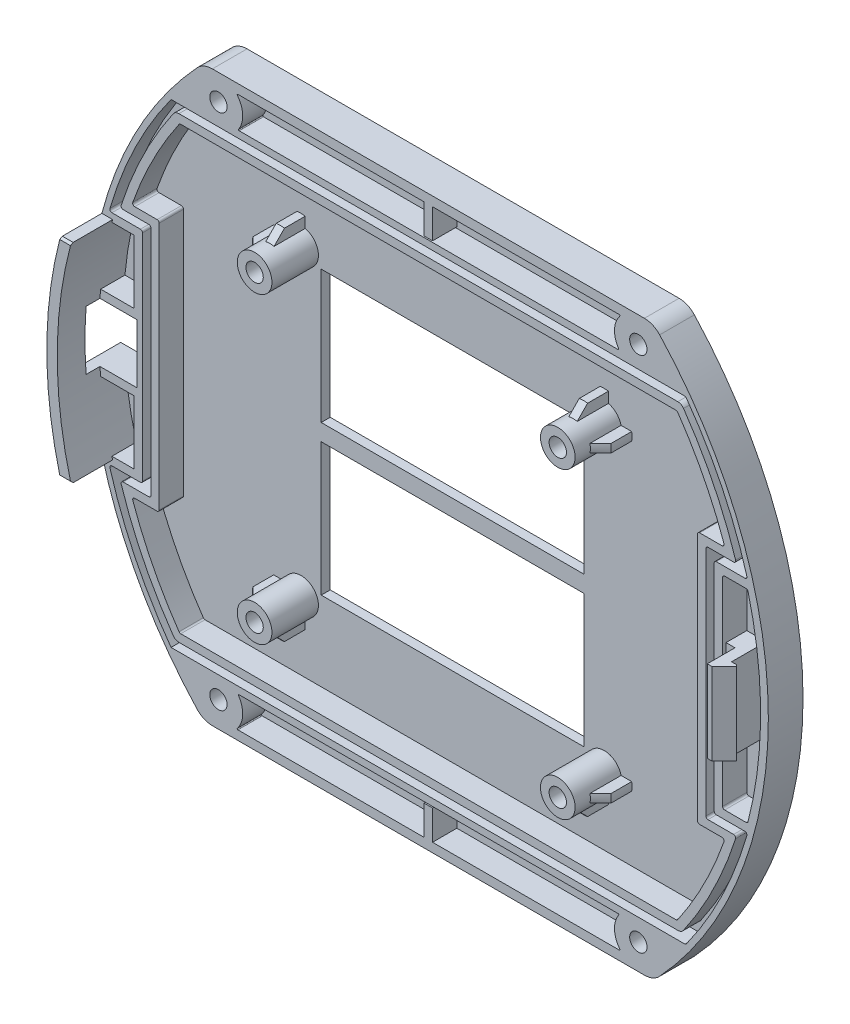
from build123d import *

# Parameters (mm, degrees)
BOSS_EXTRUDE1_DEPTH  = 5
BOSS_EXTRUDE2_DEPTH  = 6
CUT_EXTRUDE2_DEPTH   = 8
SKETCH8_W            = 1.5
SKETCH8_H            = 11.8
BOSS_EXTRUDE4_DEPTH  = 3.5
SKETCH9_W            = 1.2
SKETCH9_H            = 11.8
BOSS_EXTRUDE5_DEPTH  = 2
CHAMFER2_SIZE        = 2
CHAMFER3_SIZE        = 0.5
BOSS_EXTRUDE6_DEPTH  = 5
SKETCH11_R           = 1.25
CUT_EXTRUDE3_DEPTH   = 5
SKETCH12_R           = 3
CUT_EXTRUDE4_DEPTH   = 2.5
CUT_EXTRUDE6_DEPTH   = 2.5
CUT_EXTRUDE7_DEPTH   = 3.5
CUT_EXTRUDE8_DEPTH   = 3.5
SKETCH16_W           = 1.5
SKETCH16_H           = 11.8
CUT_EXTRUDE10_DEPTH  = 3.5
SKETCH17_W           = 1.297881394
SKETCH17_H           = 11.8
BOSS_EXTRUDE7_DEPTH  = 3
SKETCH19_W           = 1.2
SKETCH19_H           = 4.4
BOSS_EXTRUDE8_DEPTH  = 3.5
CHAMFER4_SIZE        = 0.3
CHAMFER5_SIZE        = 0.3
CHAMFER8_SIZE        = 0.5
CUT_EXTRUDE11_START  = -3.5
CUT_EXTRUDE11_DEPTH  = 3.5
SKETCH22_R           = 2.5
SKETCH22_R_2         = 1.25
BOSS_EXTRUDE9_DEPTH  = 6.7
BOSS_EXTRUDE10_DEPTH = 5
CHAMFER9_SIZE        = 2
SKETCH24_W           = 37.9
SKETCH24_H           = 19.15
CUT_EXTRUDE12_DEPTH  = 1.5
CUT_EXTRUDE13_DEPTH  = 0.2
FILLET1_R            = 2
FILLET2_R            = 2
FILLET3_R            = 2
FILLET4_R            = 2
FILLET5_R            = 3
FILLET6_R            = 0.3
FILLET7_R            = 0.3
FILLET8_R            = 0.3
FILLET9_R            = 0.3
FILLET10_R           = 0.3
FILLET11_R           = 0.3
FILLET13_R           = 0.3
FILLET14_R           = 0.3
FILLET15_R           = 0.3
FILLET16_R           = 0.3
FILLET17_R           = 0.3
FILLET18_R           = 0.3
FILLET19_R           = 0.3
FILLET20_R           = 0.3
FILLET21_R           = 0.3
FILLET22_R           = 0.3
FILLET23_R           = 0.3
FILLET24_R           = 0.3
FILLET26_R           = 0.3
FILLET27_R           = 0.3
FILLET28_R           = 0.3
FILLET29_R           = 0.3
FILLET30_R           = 0.3
FILLET31_R           = 0.3
FILLET32_R           = 0.3
FILLET33_R           = 0.3
FILLET34_R           = 0.3
FILLET35_R           = 0.3
FILLET36_R           = 0.3
FILLET37_R           = 0.3
FILLET38_R           = 0.3
FILLET39_R           = 0.3
FILLET40_R           = 0.3
FILLET42_R           = 0.5
FILLET43_R           = 0.5
FILLET44_R           = 0.5
FILLET45_R           = 0.5


# Some blends are built 0.0001 mm under size
with BuildPart() as part:
    # Sketch1 → Boss-Extrude1 (new body)
    with BuildSketch(Plane.XY):
        with BuildLine():
            Line((-37.5, -35), (37.5, -35))
            ThreePointArc((37.5, -35), (49.002118606, 0), (37.5, 35))
            Line((37.5, 35), (-37.5, 35))
            ThreePointArc((-37.5, 35), (-49.002118606, 0), (-37.5, -35))
        make_face()
    extrude(amount=BOSS_EXTRUDE1_DEPTH)

    # Sketch2 → Boss-Extrude2 (add)
    with BuildSketch(Plane.XY.offset(5)):
        with BuildLine():
            Line((-45.511202871, 15), (-47.063561053, 15))
            ThreePointArc((-47.063561053, 15), (-49.002118606, 0), (-47.063561053, -15))
            Line((-47.063561053, -15), (-45.511202871, -15))
            ThreePointArc((-45.511202871, -15), (-47.502118606, 0), (-45.511202871, 15))
        make_face()
    extrude(amount=BOSS_EXTRUDE2_DEPTH)

    # Sketch6 → Cut-Extrude2 (cut)
    with BuildSketch(Plane(origin=(-42, 0, 0), x_dir=(0, 0, -1), z_dir=(1, 0, 0))):
        Polygon((-7, 0), (-7, 4.25), (0, 4.25), (0, -4.25), (-7, -4.25), align=None)
    extrude(amount=-CUT_EXTRUDE2_DEPTH, mode=Mode.SUBTRACT)

    # Sketch8 → Boss-Extrude4 (add)
    with BuildSketch(Plane.XY.offset(5)):
        with Locations((44.45, 0)):
            Rectangle(SKETCH8_W, SKETCH8_H)
    extrude(amount=BOSS_EXTRUDE4_DEPTH)

    # Sketch9 → Boss-Extrude5 (add)
    with BuildSketch(Plane.XY.offset(6.5)):
        with Locations((45.8, 0)):
            Rectangle(SKETCH9_W, SKETCH9_H)
    extrude(amount=BOSS_EXTRUDE5_DEPTH)

    # Chamfer2
    chamfer2_edges = [part.edges().sort_by_distance(p)[0] for p in [
        (46.4, 0, 8.5),
    ]]
    chamfer(chamfer2_edges, length=CHAMFER2_SIZE - 0.0001)  # a hair under: the kernel refuses the full size

    # Chamfer3
    # the kernel refuses this chamfer: 0.5 mm, written as the material it takes off along each edge
    with BuildSketch(Plane(origin=(46.4, 7.185841494, 6.5), x_dir=(0.0274958766105822, 0, 0.999621916911297), z_dir=(0, -1, 0))) as chamfer3_piece_1:
        Polygon((CHAMFER3_SIZE * 0.999621916911, CHAMFER3_SIZE * 0.0274958766106), (-CHAMFER3_SIZE * 0.0274958766106, CHAMFER3_SIZE * 0.999621916911), (0, 0), align=None)
    extrude(amount=14.371682988, mode=Mode.SUBTRACT)

    # Sketch10 → Boss-Extrude6 (add)
    with BuildSketch(Plane.XY):
        with BuildLine():
            Line((-32.429353047, 41), (32.429353047, 41))
            ThreePointArc((32.429353047, 41), (35.064643956, 38.084483259), (37.5, 35))
            Line((37.5, 35), (-37.5, 35))
            ThreePointArc((-37.5, 35), (-35.064643956, 38.084483259), (-32.429353047, 41))
        make_face()
        with BuildLine():
            Line((-32.429353047, -41), (32.429353047, -41))
            ThreePointArc((32.429353047, -41), (35.064643956, -38.084483259), (37.5, -35))
            Line((37.5, -35), (-37.5, -35))
            ThreePointArc((-37.5, -35), (-35.064643956, -38.084483259), (-32.429353047, -41))
        make_face()
    extrude(amount=BOSS_EXTRUDE6_DEPTH)

    # Sketch11 → Cut-Extrude3 (cut)
    with BuildSketch(Plane.XY.offset(5)):
        with Locations((-30.264120819, -37.307191424)):
            Circle(SKETCH11_R)
        with Locations(Location((30.264120819, -37.307191424, 0), (0, 0, 180))):
            Circle(SKETCH11_R)
        with Locations((30.264120819, 37.307191424)):
            Circle(SKETCH11_R)
        with Locations(Location((-30.264120819, 37.307191424, 0), (0, 0, 180))):
            Circle(SKETCH11_R)
    extrude(amount=-CUT_EXTRUDE3_DEPTH, mode=Mode.SUBTRACT)

    # Sketch12 → Cut-Extrude4 (cut)
    with BuildSketch(Plane(origin=(0, 0, 0), x_dir=(-1, 0, 0), z_dir=(0, 0, -1))):
        with Locations((-30.264120819, 37.307191424)):
            Circle(SKETCH12_R)
        with Locations((30.264120819, 37.307191424)):
            Circle(SKETCH12_R)
        with Locations((30.264120819, -37.307191424)):
            Circle(SKETCH12_R)
        with Locations((-30.264120819, -37.307191424)):
            Circle(SKETCH12_R)
    extrude(amount=-CUT_EXTRUDE4_DEPTH, mode=Mode.SUBTRACT)

    # Sketch13 → Cut-Extrude6 (cut)
    with BuildSketch(Plane.XY.offset(5)):
        with BuildLine():
            Line((-46.016485165, 15.8), (-41.202118606, 15.8))
            Line((-41.202118606, 15.8), (-41.202118606, -15.8))
            Line((-41.202118606, -15.8), (-46.016485165, -15.8))
            ThreePointArc((-46.016485165, -15.8), (-42.369685973, -25.394932592), (-37.094018837, -34.2))
            Line((-37.094018837, -34.2), (37.094018837, -34.2))
            ThreePointArc((37.094018837, -34.2), (42.369685973, -25.394932592), (46.016485165, -15.8))
            Line((46.016485165, -15.8), (41.202118606, -15.8))
            Line((41.202118606, -15.8), (41.202118606, 15.8))
            Line((41.202118606, 15.8), (46.016485165, 15.8))
            ThreePointArc((46.016485165, 15.8), (42.369685973, 25.394932592), (37.094018837, 34.2))
            Line((37.094018837, 34.2), (-37.094018837, 34.2))
            ThreePointArc((-37.094018837, 34.2), (-42.369685973, 25.394932592), (-46.016485165, 15.8))
        make_face()
        with BuildLine():
            Line((-44.408101654, 17), (-40.002118606, 17))
            Line((-40.002118606, 17), (-40.002118606, -17))
            Line((-40.002118606, -17), (-44.408101654, -17))
            ThreePointArc((-44.408101654, -17), (-41.18947636, -25.077460707), (-36.779749621, -32.571406954))
            ThreePointArc((-36.779749621, -32.571406954), (-36.422004487, -32.886399163), (-35.959082762, -33))
            Line((-35.959082762, -33), (35.959082762, -33))
            ThreePointArc((35.959082762, -33), (36.422004487, -32.886399163), (36.779749621, -32.571406954))
            ThreePointArc((36.779749621, -32.571406954), (41.18947636, -25.077460707), (44.408101654, -17))
            Line((44.408101654, -17), (40.002118606, -17))
            Line((40.002118606, -17), (40.002118606, 17))
            Line((40.002118606, 17), (44.408101654, 17))
            ThreePointArc((44.408101654, 17), (41.18947636, 25.077460707), (36.779749621, 32.571406954))
            ThreePointArc((36.779749621, 32.571406954), (36.422004487, 32.886399163), (35.959082762, 33))
            Line((35.959082762, 33), (-35.959082762, 33))
            ThreePointArc((-35.959082762, 33), (-36.422004487, 32.886399163), (-36.779749621, 32.571406954))
            ThreePointArc((-36.779749621, 32.571406954), (-41.18947636, 25.077460707), (-44.408101654, 17))
        make_face(mode=Mode.SUBTRACT)
    extrude(amount=-CUT_EXTRUDE6_DEPTH, mode=Mode.SUBTRACT)

    # Sketch14 → Cut-Extrude7 (cut)
    with BuildSketch(Plane.XY.offset(5)):
        with BuildLine():
            Line((-42.750700857, 18.2), (-38.802118606, 18.2))
            Line((-38.802118606, 18.2), (-38.802118606, -18.2))
            Line((-38.802118606, -18.2), (-42.750700857, -18.2))
            ThreePointArc((-42.750700857, -18.2), (-39.769338876, -25.236666753), (-35.854513855, -31.8))
            Line((-35.854513855, -31.8), (35.854513855, -31.8))
            ThreePointArc((35.854513855, -31.8), (39.769338876, -25.236666753), (42.750700857, -18.2))
            Line((42.750700857, -18.2), (38.802118606, -18.2))
            Line((38.802118606, -18.2), (38.802118606, 18.2))
            Line((38.802118606, 18.2), (42.750700857, 18.2))
            ThreePointArc((42.750700857, 18.2), (39.769338876, 25.236666753), (35.854513855, 31.8))
            Line((35.854513855, 31.8), (-35.854513855, 31.8))
            ThreePointArc((-35.854513855, 31.8), (-39.769338876, 25.236666753), (-42.750700857, 18.2))
        make_face()
    extrude(amount=-CUT_EXTRUDE7_DEPTH, mode=Mode.SUBTRACT)

    # Sketch15 → Cut-Extrude8 (cut)
    with BuildSketch(Plane.XY.offset(5)):
        with BuildLine():
            Line((27.519198247, -39.676729192), (-27.457272673, -39.676729192))
            ThreePointArc((-27.457272673, -39.676729192), (-27.547444124, -39.61996239), (-27.535240677, -39.51411138))
            ThreePointArc((-27.535240677, -39.51411138), (-26.767025424, -37.465049531), (-27.365905875, -35.360257062))
            ThreePointArc((-27.365905875, -35.360257062), (-27.371435384, -35.25732315), (-27.283099734, -35.204193322))
            Line((-27.283099734, -35.204193322), (27.345025309, -35.204193322))
            ThreePointArc((27.345025309, -35.204193322), (27.433360959, -35.25732315), (27.42783145, -35.360257062))
            ThreePointArc((27.42783145, -35.360257062), (26.828950999, -37.465049531), (27.597166252, -39.51411138))
            ThreePointArc((27.597166252, -39.51411138), (27.609369698, -39.61996239), (27.519198247, -39.676729192))
        make_face()
        with BuildLine():
            Line((-27.275471399, 35.200209949), (27.337396974, 35.200209949))
            ThreePointArc((27.337396974, 35.200209949), (27.425643641, 35.253172456), (27.420415013, 35.355959434))
            ThreePointArc((27.420415013, 35.355959434), (26.82910479, 37.453476833), (27.593530857, 39.494280549))
            ThreePointArc((27.593530857, 39.494280549), (27.605594511, 39.600076857), (27.515458985, 39.65676881))
            Line((27.515458985, 39.65676881), (-27.45353341, 39.65676881))
            ThreePointArc((-27.45353341, 39.65676881), (-27.543668936, 39.600076857), (-27.531605282, 39.494280549))
            ThreePointArc((-27.531605282, 39.494280549), (-26.767179216, 37.453476833), (-27.358489438, 35.355959434))
            ThreePointArc((-27.358489438, 35.355959434), (-27.363718066, 35.253172456), (-27.275471399, 35.200209949))
        make_face()
    extrude(amount=-CUT_EXTRUDE8_DEPTH, mode=Mode.SUBTRACT)

    # Sketch16 → Cut-Extrude10 (cut)
    with BuildSketch(Plane.XY.offset(5)):
        with BuildLine():
            Line((42.402118606, -14.6), (42.402118606, 14.6))
            Line((42.402118606, 14.6), (46.016485165, 14.6))
            ThreePointArc((46.016485165, 14.6), (47.887879649, 0), (46.016485165, -14.6))
            Line((46.016485165, -14.6), (42.402118606, -14.6))
        make_face()
        with Locations((44.45, 0)):
            Rectangle(SKETCH16_W, SKETCH16_H, mode=Mode.SUBTRACT)
    extrude(amount=-CUT_EXTRUDE10_DEPTH, mode=Mode.SUBTRACT)

    # Sketch17 → Boss-Extrude7 (add)
    with BuildSketch(Plane.XY.offset(1.5)):
        with Locations((43.051059303, 0)):
            Rectangle(SKETCH17_W, SKETCH17_H)
    extrude(amount=BOSS_EXTRUDE7_DEPTH)

    # Sketch19 → Boss-Extrude8 (add)
    with BuildSketch(Plane.XY.offset(1.5)):
        with Locations((0, -37.6)):
            Rectangle(SKETCH19_W, SKETCH19_H)
        with Locations((0, 37.6)):
            Rectangle(SKETCH19_W, SKETCH19_H)
    extrude(amount=BOSS_EXTRUDE8_DEPTH)

    # Chamfer4
    chamfer4_edges = [part.edges().sort_by_distance(p)[0] for p in [
        (-46.287381962, -15, 11),
    ]]
    chamfer(chamfer4_edges, length=CHAMFER4_SIZE)

    # Chamfer5
    chamfer5_edges = [part.edges().sort_by_distance(p)[0] for p in [
        (-46.287381962, 15, 11),
    ]]
    chamfer(chamfer5_edges, length=CHAMFER5_SIZE)

    # Chamfer8
    chamfer8_edges = [part.edges().sort_by_distance(p)[0] for p in [
        (-45.424426502, 4.25, 0),
        (-45.424426502, -4.25, 0),
    ]]
    chamfer(chamfer8_edges, length=CHAMFER8_SIZE)

    # Sketch21 → Cut-Extrude11 (cut)
    with BuildSketch(Plane.XY.offset(5).offset(CUT_EXTRUDE11_START)):
        with BuildLine():
            Line((-42.402118606, -14.6), (-45.617745767, -14.6))
            ThreePointArc((-45.617745767, -14.6), (-46.615655456, -10.057892496), (-47.243262872, -5.45))
            Line((-47.243262872, -5.45), (-42.402118606, -5.45))
            Line((-42.402118606, -5.45), (-42.402118606, -14.6))
        make_face()
        with BuildLine():
            Line((-42.402118606, 14.6), (-42.402118606, 5.45))
            Line((-42.402118606, 5.45), (-47.243262872, 5.45))
            ThreePointArc((-47.243262872, 5.45), (-46.615655456, 10.057892496), (-45.617745767, 14.6))
            Line((-45.617745767, 14.6), (-42.402118606, 14.6))
        make_face()
    extrude(amount=CUT_EXTRUDE11_DEPTH, mode=Mode.SUBTRACT)

    # Sketch22 → Boss-Extrude9 (add)
    # profile 1 of 4: a face of its own
    with BuildSketch(Plane.XY.offset(1.5)):
        with Locations((-21.85, 21.85)):
            Circle(SKETCH22_R)
        with Locations((-21.85, 21.85)):
            Circle(SKETCH22_R_2, mode=Mode.SUBTRACT)
    # profile 2 of 4: a face of its own
    with BuildSketch(Plane.XY.offset(1.5)):
        with Locations((-21.85, -21.85)):
            Circle(SKETCH22_R)
        with Locations((-21.85, -21.85)):
            Circle(SKETCH22_R_2, mode=Mode.SUBTRACT)
    # profile 3 of 4: a face of its own
    with BuildSketch(Plane.XY.offset(1.5)):
        with Locations(Location((21.85, -21.85, 0), (0, 0, 180))):
            Circle(SKETCH22_R)
        with Locations(Location((21.85, -21.85, 0), (0, 0, 180))):
            Circle(SKETCH22_R_2, mode=Mode.SUBTRACT)
    # profile 4 of 4: a face of its own
    with BuildSketch(Plane.XY.offset(1.5)):
        with Locations(Location((21.85, 21.85, 0), (0, 0, 180))):
            Circle(SKETCH22_R)
        with Locations(Location((21.85, 21.85, 0), (0, 0, 180))):
            Circle(SKETCH22_R_2, mode=Mode.SUBTRACT)
    extrude(amount=BOSS_EXTRUDE9_DEPTH)

    # Sketch23 → Boss-Extrude10 (add)
    with BuildSketch(Plane.XY.offset(1.5)):
        with BuildLine():
            Line((-21.25, 24.27693222), (-21.25, 25.804743987))
            ThreePointArc((-21.25, 25.804743987), (-21.85, 25.85), (-22.45, 25.804743987))
            Line((-22.45, 25.804743987), (-22.45, 24.27693222))
            ThreePointArc((-22.45, 24.27693222), (-21.85, 24.35), (-21.25, 24.27693222))
        make_face()
        with BuildLine():
            Line((-24.27693222, 22.45), (-25.804743987, 22.45))
            ThreePointArc((-25.804743987, 22.45), (-25.85, 21.85), (-25.804743987, 21.25))
            Line((-25.804743987, 21.25), (-24.27693222, 21.25))
            ThreePointArc((-24.27693222, 21.25), (-24.35, 21.85), (-24.27693222, 22.45))
        make_face()
        with BuildLine():
            Line((-24.27693222, -21.25), (-25.804743987, -21.25))
            ThreePointArc((-25.804743987, -21.25), (-25.85, -21.85), (-25.804743987, -22.45))
            Line((-25.804743987, -22.45), (-24.27693222, -22.45))
            ThreePointArc((-24.27693222, -22.45), (-24.35, -21.85), (-24.27693222, -21.25))
        make_face()
        with BuildLine():
            Line((-22.45, -24.27693222), (-22.45, -25.804743987))
            ThreePointArc((-22.45, -25.804743987), (-21.85, -25.85), (-21.25, -25.804743987))
            Line((-21.25, -25.804743987), (-21.25, -24.27693222))
            ThreePointArc((-21.25, -24.27693222), (-21.85, -24.35), (-22.45, -24.27693222))
        make_face()
        with BuildLine():
            Line((21.25, -24.27693222), (21.25, -25.804743987))
            ThreePointArc((21.25, -25.804743987), (21.85, -25.85), (22.45, -25.804743987))
            Line((22.45, -25.804743987), (22.45, -24.27693222))
            ThreePointArc((22.45, -24.27693222), (21.85, -24.35), (21.25, -24.27693222))
        make_face()
        with BuildLine():
            Line((24.27693222, -22.45), (25.804743987, -22.45))
            ThreePointArc((25.804743987, -22.45), (25.85, -21.85), (25.804743987, -21.25))
            Line((25.804743987, -21.25), (24.27693222, -21.25))
            ThreePointArc((24.27693222, -21.25), (24.35, -21.85), (24.27693222, -22.45))
        make_face()
        with BuildLine():
            Line((24.27693222, 21.25), (25.804743987, 21.25))
            ThreePointArc((25.804743987, 21.25), (25.85, 21.85), (25.804743987, 22.45))
            Line((25.804743987, 22.45), (24.27693222, 22.45))
            ThreePointArc((24.27693222, 22.45), (24.35, 21.85), (24.27693222, 21.25))
        make_face()
        with BuildLine():
            Line((22.45, 24.27693222), (22.45, 25.804743987))
            ThreePointArc((22.45, 25.804743987), (21.85, 25.85), (21.25, 25.804743987))
            Line((21.25, 25.804743987), (21.25, 24.27693222))
            ThreePointArc((21.25, 24.27693222), (21.85, 24.35), (22.45, 24.27693222))
        make_face()
    extrude(amount=BOSS_EXTRUDE10_DEPTH)

    # Chamfer9
    # the kernel refuses this chamfer: 2 mm, written as the material it takes off along each edge
    with BuildSketch(Plane(origin=(-21.85, 21.85, 6.5), x_dir=(-0.13396361958616776, 0.9909862504734225, 0), z_dir=(0.9909862504734225, 0.13396361958616776, 0))) as chamfer9_piece_1_section:
        Polygon((4, -CHAMFER9_SIZE), (4 - CHAMFER9_SIZE, 0), (4, 0), align=None)
    chamfer9_piece_1 = revolve(axis=Axis((-21.85, 21.85, 6.5), (0, 0, 1)), revolution_arc=164.602609378, mode=Mode.PRIVATE)
    chamfer9_piece_1 = chamfer9_piece_1 - Plane(origin=(-21.85, 21.85, 5.240917107), x_dir=(1, 0, 0), z_dir=(0, 0, -1)) * Cylinder(2.5, 17, mode=Mode.PRIVATE)
    add(chamfer9_piece_1, mode=Mode.SUBTRACT)
    with BuildSketch(Plane(origin=(-21.85, 21.85, 6.5), x_dir=(0.9909862504734135, 0.13396361958623368, 0), z_dir=(0.13396361958623368, -0.9909862504734135, 0))) as chamfer9_piece_2_section:
        Polygon((4, -CHAMFER9_SIZE), (4 - CHAMFER9_SIZE, 0), (4, 0), align=None)
    chamfer9_piece_2 = revolve(axis=Axis((-21.85, 21.85, 6.5), (0, 0, 1)), revolution_arc=164.602609378, mode=Mode.PRIVATE)
    chamfer9_piece_2 = chamfer9_piece_2 - Plane(origin=(-21.85, 21.85, 5.240917107), x_dir=(1, 0, 0), z_dir=(0, 0, -1)) * Cylinder(2.5, 17, mode=Mode.PRIVATE)
    add(chamfer9_piece_2, mode=Mode.SUBTRACT)
    with BuildSketch(Plane(origin=(21.85, 21.85, 6.5), x_dir=(0.9909862504734142, 0.13396361958622804, 0), z_dir=(0.13396361958622804, -0.9909862504734142, 0))) as chamfer9_piece_3_section:
        Polygon((4, -CHAMFER9_SIZE), (4 - CHAMFER9_SIZE, 0), (4, 0), align=None)
    chamfer9_piece_3 = revolve(axis=Axis((21.85, 21.85, 6.5), (0, 0, 1)), revolution_arc=164.602609378, mode=Mode.PRIVATE)
    chamfer9_piece_3 = chamfer9_piece_3 - Plane(origin=(21.85, 21.85, 5.240917107), x_dir=(-1, 0, 0), z_dir=(0, 0, -1)) * Cylinder(2.5, 17, mode=Mode.PRIVATE)
    add(chamfer9_piece_3, mode=Mode.SUBTRACT)
    with BuildSketch(Plane(origin=(21.85, 21.85, 6.5), x_dir=(0.133963619586182, -0.9909862504734205, 0), z_dir=(-0.9909862504734205, -0.133963619586182, 0))) as chamfer9_piece_4_section:
        Polygon((4, -CHAMFER9_SIZE), (4 - CHAMFER9_SIZE, 0), (4, 0), align=None)
    chamfer9_piece_4 = revolve(axis=Axis((21.85, 21.85, 6.5), (0, 0, 1)), revolution_arc=164.602609378, mode=Mode.PRIVATE)
    chamfer9_piece_4 = chamfer9_piece_4 - Plane(origin=(21.85, 21.85, 5.240917107), x_dir=(-1, 0, 0), z_dir=(0, 0, -1)) * Cylinder(2.5, 17, mode=Mode.PRIVATE)
    add(chamfer9_piece_4, mode=Mode.SUBTRACT)
    with BuildSketch(Plane(origin=(21.85, -21.85, 6.5), x_dir=(0.13396361958618552, -0.9909862504734199, 0), z_dir=(-0.9909862504734199, -0.13396361958618552, 0))) as chamfer9_piece_5_section:
        Polygon((4, -CHAMFER9_SIZE), (4 - CHAMFER9_SIZE, 0), (4, 0), align=None)
    chamfer9_piece_5 = revolve(axis=Axis((21.85, -21.85, 6.5), (0, 0, 1)), revolution_arc=164.602609378, mode=Mode.PRIVATE)
    chamfer9_piece_5 = chamfer9_piece_5 - Plane(origin=(21.85, -21.85, 5.240917107), x_dir=(-1, 0, 0), z_dir=(0, 0, -1)) * Cylinder(2.5, 17, mode=Mode.PRIVATE)
    add(chamfer9_piece_5, mode=Mode.SUBTRACT)
    with BuildSketch(Plane(origin=(21.85, -21.85, 6.5), x_dir=(-0.9909862504734142, -0.1339636195862288, 0), z_dir=(-0.1339636195862288, 0.9909862504734142, 0))) as chamfer9_piece_6_section:
        Polygon((4, -CHAMFER9_SIZE), (4 - CHAMFER9_SIZE, 0), (4, 0), align=None)
    chamfer9_piece_6 = revolve(axis=Axis((21.85, -21.85, 6.5), (0, 0, 1)), revolution_arc=164.602609378, mode=Mode.PRIVATE)
    chamfer9_piece_6 = chamfer9_piece_6 - Plane(origin=(21.85, -21.85, 5.240917107), x_dir=(-1, 0, 0), z_dir=(0, 0, -1)) * Cylinder(2.5, 17, mode=Mode.PRIVATE)
    add(chamfer9_piece_6, mode=Mode.SUBTRACT)
    with BuildSketch(Plane(origin=(-21.85, -21.85, 6.5), x_dir=(-0.9909862504734135, -0.13396361958623368, 0), z_dir=(-0.13396361958623368, 0.9909862504734135, 0))) as chamfer9_piece_7_section:
        Polygon((4, -CHAMFER9_SIZE), (4 - CHAMFER9_SIZE, 0), (4, 0), align=None)
    chamfer9_piece_7 = revolve(axis=Axis((-21.85, -21.85, 6.5), (0, 0, 1)), revolution_arc=164.602609378, mode=Mode.PRIVATE)
    chamfer9_piece_7 = chamfer9_piece_7 - Plane(origin=(-21.85, -21.85, 5.240917107), x_dir=(1, 0, 0), z_dir=(0, 0, -1)) * Cylinder(2.5, 17, mode=Mode.PRIVATE)
    add(chamfer9_piece_7, mode=Mode.SUBTRACT)
    with BuildSketch(Plane(origin=(-21.85, -21.85, 6.5), x_dir=(-0.1339636195861756, 0.9909862504734214, 0), z_dir=(0.9909862504734214, 0.1339636195861756, 0))) as chamfer9_piece_8_section:
        Polygon((4, -CHAMFER9_SIZE), (4 - CHAMFER9_SIZE, 0), (4, 0), align=None)
    chamfer9_piece_8 = revolve(axis=Axis((-21.85, -21.85, 6.5), (0, 0, 1)), revolution_arc=164.602609378, mode=Mode.PRIVATE)
    chamfer9_piece_8 = chamfer9_piece_8 - Plane(origin=(-21.85, -21.85, 5.240917107), x_dir=(1, 0, 0), z_dir=(0, 0, -1)) * Cylinder(2.5, 17, mode=Mode.PRIVATE)
    add(chamfer9_piece_8, mode=Mode.SUBTRACT)

    # Sketch24 → Cut-Extrude12 (cut)
    with BuildSketch(Plane.XY.offset(1.5)):
        Polygon((0, -1.2), (-18.95, -1.2), (-18.95, -20.35), (18.95, -20.35), (18.95, -1.2), align=None)
        with Locations((0, 10.775)):
            Rectangle(SKETCH24_W, SKETCH24_H)
    extrude(amount=-CUT_EXTRUDE12_DEPTH, mode=Mode.SUBTRACT)

    # Sketch26 → Cut-Extrude13 (cut)
    with BuildSketch(Plane(origin=(0, 0, 0), x_dir=(-1, 0, 0), z_dir=(0, 0, -1))):
        Polygon((0, 25), (-25, 25), (-25, -25), (25, -25), (25, 25), align=None)
    extrude(amount=-CUT_EXTRUDE13_DEPTH, mode=Mode.SUBTRACT)

    # Fillet1
    fillet1_edges = [part.edges().sort_by_distance(p)[0] for p in [
        (25, 25, 0.1),
    ]]
    fillet(fillet1_edges, radius=FILLET1_R)

    # Fillet2
    fillet2_edges = [part.edges().sort_by_distance(p)[0] for p in [
        (-25, 25, 0.1),
    ]]
    fillet(fillet2_edges, radius=FILLET2_R)

    # Fillet3
    fillet3_edges = [part.edges().sort_by_distance(p)[0] for p in [
        (-25, -25, 0.1),
    ]]
    fillet(fillet3_edges, radius=FILLET3_R)

    # Fillet4
    fillet4_edges = [part.edges().sort_by_distance(p)[0] for p in [
        (25, -25, 0.1),
    ]]
    fillet(fillet4_edges, radius=FILLET4_R)

    # Fillet5
    fillet5_edges = [part.edges().sort_by_distance(p)[0] for p in [
        (-32.429353047, 41, 2.5),
        (32.429353047, 41, 2.5),
        (-32.429353047, -41, 2.5),
        (32.429353047, -41, 2.5),
    ]]
    fillet(fillet5_edges, radius=FILLET5_R)

    # Fillet6
    fillet6_edges = [part.edges().sort_by_distance(p)[0] for p in [
        (-44.408101654, -17, 3.75),
    ]]
    fillet(fillet6_edges, radius=FILLET6_R)

    # Fillet7
    fillet7_edges = [part.edges().sort_by_distance(p)[0] for p in [
        (-46.016485165, -15.8, 3.75),
    ]]
    fillet(fillet7_edges, radius=FILLET7_R)

    # Fillet8
    fillet8_edges = [part.edges().sort_by_distance(p)[0] for p in [
        (-41.202118606, -15.8, 3.75),
    ]]
    fillet(fillet8_edges, radius=FILLET8_R)

    # Fillet9
    fillet9_edges = [part.edges().sort_by_distance(p)[0] for p in [
        (-40.002118606, -17, 3.75),
    ]]
    fillet(fillet9_edges, radius=FILLET9_R)

    # Fillet10
    fillet10_edges = [part.edges().sort_by_distance(p)[0] for p in [
        (-40.002118606, 17, 3.75),
    ]]
    fillet(fillet10_edges, radius=FILLET10_R)

    # Fillet11
    fillet11_edges = [part.edges().sort_by_distance(p)[0] for p in [
        (-41.202118606, 15.8, 3.75),
    ]]
    fillet(fillet11_edges, radius=FILLET11_R)

    # Fillet13
    fillet13_edges = [part.edges().sort_by_distance(p)[0] for p in [
        (-46.016485165, 15.8, 3.75),
    ]]
    fillet(fillet13_edges, radius=FILLET13_R)

    # Fillet14
    fillet14_edges = [part.edges().sort_by_distance(p)[0] for p in [
        (-44.408101654, 17, 3.75),
    ]]
    fillet(fillet14_edges, radius=FILLET14_R)

    # Fillet15
    fillet15_edges = [part.edges().sort_by_distance(p)[0] for p in [
        (-42.750700857, 18.2, 3.25),
    ]]
    fillet(fillet15_edges, radius=FILLET15_R)

    # Fillet16
    fillet16_edges = [part.edges().sort_by_distance(p)[0] for p in [
        (-38.802118606, 18.2, 3.25),
    ]]
    fillet(fillet16_edges, radius=FILLET16_R)

    # Fillet17
    fillet17_edges = [part.edges().sort_by_distance(p)[0] for p in [
        (-35.854513855, 31.8, 3.25),
    ]]
    fillet(fillet17_edges, radius=FILLET17_R)

    # Fillet18
    fillet18_edges = [part.edges().sort_by_distance(p)[0] for p in [
        (-38.802118606, -18.2, 3.25),
    ]]
    fillet(fillet18_edges, radius=FILLET18_R)

    # Fillet19
    fillet19_edges = [part.edges().sort_by_distance(p)[0] for p in [
        (-42.750700857, -18.2, 3.25),
    ]]
    fillet(fillet19_edges, radius=FILLET19_R)

    # Fillet20
    fillet20_edges = [part.edges().sort_by_distance(p)[0] for p in [
        (-35.854513855, -31.8, 3.25),
    ]]
    fillet(fillet20_edges, radius=FILLET20_R)

    # Fillet21
    fillet21_edges = [part.edges().sort_by_distance(p)[0] for p in [
        (35.854513855, -31.8, 3.25),
    ]]
    fillet(fillet21_edges, radius=FILLET21_R)

    # Fillet22
    fillet22_edges = [part.edges().sort_by_distance(p)[0] for p in [
        (38.802118606, -18.2, 3.25),
        (42.750700857, -18.2, 3.25),
    ]]
    fillet(fillet22_edges, radius=FILLET22_R)

    # Fillet23
    fillet23_edges = [part.edges().sort_by_distance(p)[0] for p in [
        (44.408101654, -17, 3.75),
    ]]
    fillet(fillet23_edges, radius=FILLET23_R)

    # Fillet24
    fillet24_edges = [part.edges().sort_by_distance(p)[0] for p in [
        (40.002118606, -17, 3.75),
    ]]
    fillet(fillet24_edges, radius=FILLET24_R)

    # Fillet26
    fillet26_edges = [part.edges().sort_by_distance(p)[0] for p in [
        (38.802118606, 18.2, 3.25),
    ]]
    fillet(fillet26_edges, radius=FILLET26_R)

    # Fillet27
    fillet27_edges = [part.edges().sort_by_distance(p)[0] for p in [
        (41.202118606, 15.8, 3.75),
    ]]
    fillet(fillet27_edges, radius=FILLET27_R)

    # Fillet28
    fillet28_edges = [part.edges().sort_by_distance(p)[0] for p in [
        (42.750700857, 18.2, 3.25),
    ]]
    fillet(fillet28_edges, radius=FILLET28_R)

    # Fillet29
    fillet29_edges = [part.edges().sort_by_distance(p)[0] for p in [
        (40.002118606, 17, 3.75),
    ]]
    fillet(fillet29_edges, radius=FILLET29_R)

    # Fillet30
    fillet30_edges = [part.edges().sort_by_distance(p)[0] for p in [
        (44.408101654, 17, 3.75),
    ]]
    fillet(fillet30_edges, radius=FILLET30_R)

    # Fillet31
    fillet31_edges = [part.edges().sort_by_distance(p)[0] for p in [
        (35.854513855, 31.8, 3.25),
    ]]
    fillet(fillet31_edges, radius=FILLET31_R)

    # Fillet32
    fillet32_edges = [part.edges().sort_by_distance(p)[0] for p in [
        (46.016485165, 15.8, 3.75),
    ]]
    fillet(fillet32_edges, radius=FILLET32_R)

    # Fillet33
    fillet33_edges = [part.edges().sort_by_distance(p)[0] for p in [
        (46.016485165, -15.8, 3.75),
    ]]
    fillet(fillet33_edges, radius=FILLET33_R)

    # Fillet34
    fillet34_edges = [part.edges().sort_by_distance(p)[0] for p in [
        (41.202118606, -15.8, 3.75),
    ]]
    fillet(fillet34_edges, radius=FILLET34_R)

    # Fillet35
    fillet35_edges = [part.edges().sort_by_distance(p)[0] for p in [
        (42.402118606, -14.6, 3.25),
    ]]
    fillet(fillet35_edges, radius=FILLET35_R)

    # Fillet36
    fillet36_edges = [part.edges().sort_by_distance(p)[0] for p in [
        (46.016485165, -14.6, 3.25),
    ]]
    fillet(fillet36_edges, radius=FILLET36_R)

    # Fillet37
    fillet37_edges = [part.edges().sort_by_distance(p)[0] for p in [
        (42.402118606, 14.6, 3.25),
    ]]
    fillet(fillet37_edges, radius=FILLET37_R)

    # Fillet38
    fillet38_edges = [part.edges().sort_by_distance(p)[0] for p in [
        (46.016485165, 14.6, 3.25),
    ]]
    fillet(fillet38_edges, radius=FILLET38_R)

    # Fillet39
    fillet39_edges = [part.edges().sort_by_distance(p)[0] for p in [
        (37.094018837, -34.2, 3.75),
    ]]
    fillet(fillet39_edges, radius=FILLET39_R)

    # Fillet40
    fillet40_edges = [part.edges().sort_by_distance(p)[0] for p in [
        (37.094018837, 34.2, 3.75),
    ]]
    fillet(fillet40_edges, radius=FILLET40_R)

    # Fillet42
    fillet42_edges = [part.edges().sort_by_distance(p)[0] for p in [
        (-27.264120819, -37.307191424, 0),
    ]]
    fillet(fillet42_edges, radius=FILLET42_R)

    # Fillet43
    fillet43_edges = [part.edges().sort_by_distance(p)[0] for p in [
        (-27.264120819, 37.307191424, 0),
    ]]
    fillet(fillet43_edges, radius=FILLET43_R)

    # Fillet44
    fillet44_edges = [part.edges().sort_by_distance(p)[0] for p in [
        (33.264120819, 37.307191424, 0),
    ]]
    fillet(fillet44_edges, radius=FILLET44_R)

    # Fillet45
    fillet45_edges = [part.edges().sort_by_distance(p)[0] for p in [
        (33.264120819, -37.307191424, 0),
    ]]
    fillet(fillet45_edges, radius=FILLET45_R)


solid = part.part
